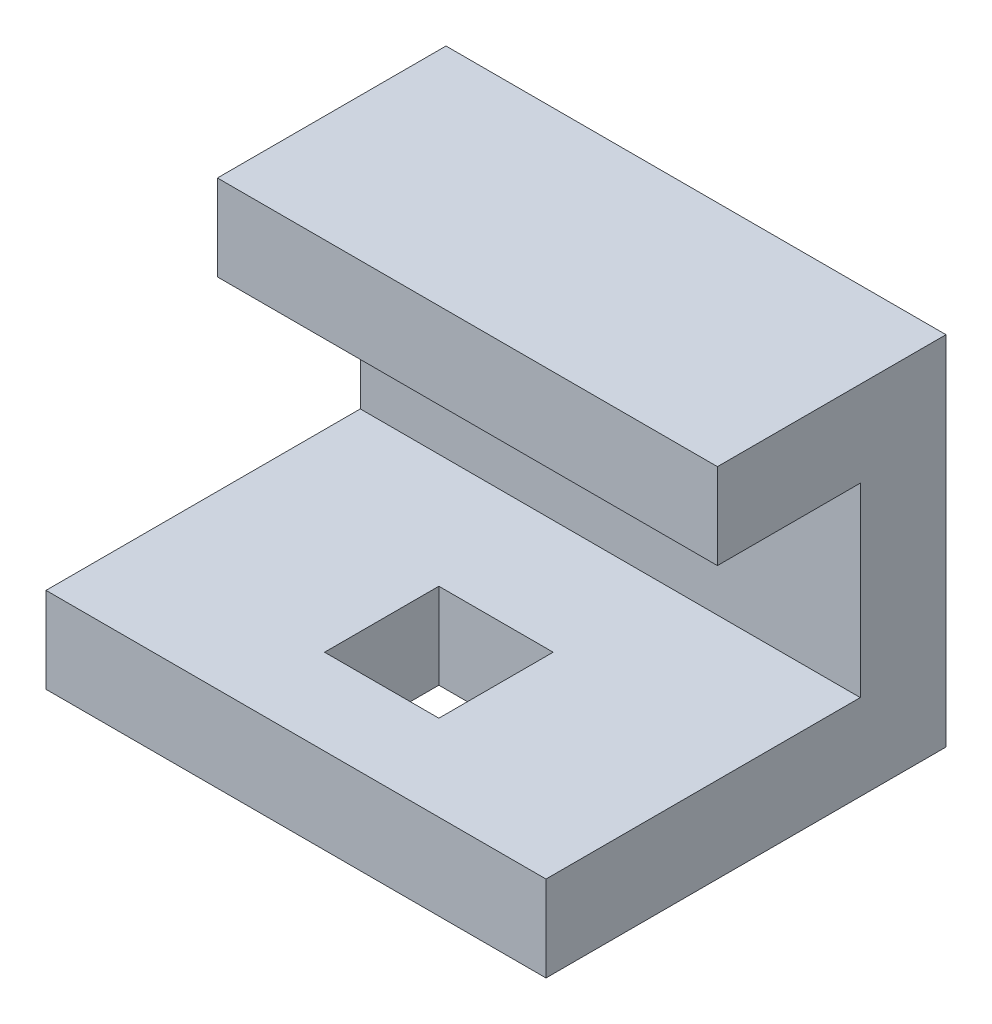
from build123d import *

# Parameters (mm, degrees)
ESBO_O1_W                = 70
ESBO_O1_H                = 50
RESSALTO_EXTRUS_O1_DEPTH = 56
ESBO_O2_W                = 44
ESBO_O2_H                = 26
CORTE_EXTRUS_O2_DEPTH    = 70
ESBO_O3_W                = 24
ESBO_O3_H                = 12
CORTE_EXTRUS_O5_DEPTH    = 103.645019363
ESBO_O4_W                = 16
ESBO_O4_H                = 16
CORTE_EXTRUS_O4_DEPTH    = 70


with BuildPart() as part:
    # Esboço1 → Ressalto-extrusão1 (new body)
    with BuildSketch(Plane.XY):
        with Locations((35, -25)):
            Rectangle(ESBO_O1_W, ESBO_O1_H)
    extrude(amount=RESSALTO_EXTRUS_O1_DEPTH)

    # Esboço2 → Corte-extrusão2 (cut)
    with BuildSketch(Plane.ZY):
        with Locations((34, -25)):
            Rectangle(ESBO_O2_W, ESBO_O2_H)
    extrude(amount=-CORTE_EXTRUS_O2_DEPTH, mode=Mode.SUBTRACT)

    # Esboço3 → Corte-extrusão5 (cut, through all)
    with BuildSketch(Plane.ZY):
        with Locations((44, -6)):
            Rectangle(ESBO_O3_W, ESBO_O3_H)
    extrude(amount=-CORTE_EXTRUS_O5_DEPTH, mode=Mode.SUBTRACT)

    # Esboço4 → Corte-extrusão4 (cut)
    with BuildSketch(Plane(origin=(0, -38, 0), x_dir=(1, 0, 0), z_dir=(0, 1, 0))):
        with Locations((35, -36)):
            Rectangle(ESBO_O4_W, ESBO_O4_H)
    extrude(amount=-CORTE_EXTRUS_O4_DEPTH, mode=Mode.SUBTRACT)


solid = part.part
